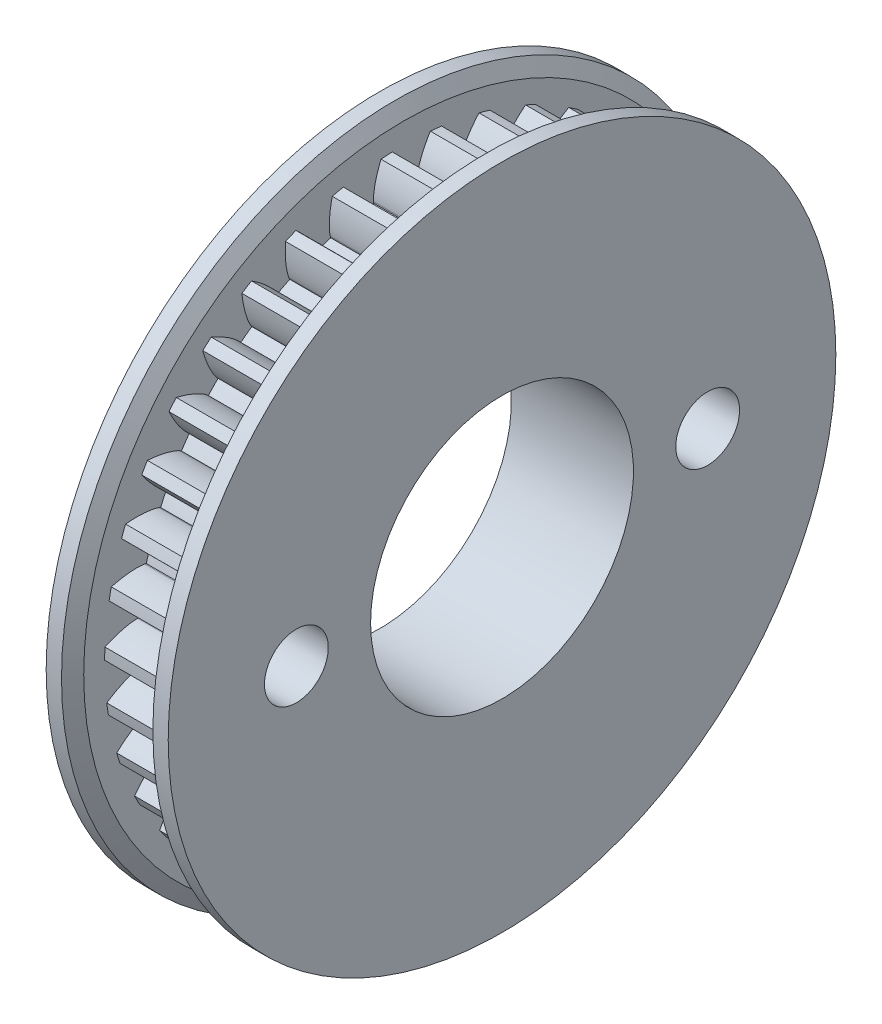
from build123d import *

# Parameters (mm, degrees)
SKETCH1_R                 = 15.915494309
BOSS_EXTRUDE1_DEPTH       = 4
CUT_EXTRUDE1_DEPTH        = 23.860575632
CIRPATTERN6_COUNT         = 38
CIRPATTERN6_COPY_1_DEPTH  = 23.860575632
CIRPATTERN6_COPY_2_DEPTH  = 23.860575632
CIRPATTERN6_COPY_3_DEPTH  = 23.860575632
CIRPATTERN6_COPY_4_DEPTH  = 23.860575632
CIRPATTERN6_COPY_5_DEPTH  = 23.860575632
CIRPATTERN6_COPY_6_DEPTH  = 23.860575632
CIRPATTERN6_COPY_7_DEPTH  = 23.860575632
CIRPATTERN6_COPY_8_DEPTH  = 23.860575632
CIRPATTERN6_COPY_9_DEPTH  = 23.860575632
CIRPATTERN6_COPY_10_DEPTH = 23.860575632
CIRPATTERN6_COPY_11_DEPTH = 23.860575632
CIRPATTERN6_COPY_12_DEPTH = 23.860575632
CIRPATTERN6_COPY_13_DEPTH = 23.860575632
CIRPATTERN6_COPY_14_DEPTH = 23.860575632
CIRPATTERN6_COPY_15_DEPTH = 23.860575632
CIRPATTERN6_COPY_16_DEPTH = 23.860575632
CIRPATTERN6_COPY_17_DEPTH = 23.860575632
CIRPATTERN6_COPY_18_DEPTH = 23.860575632
CIRPATTERN6_COPY_19_DEPTH = 23.860575632
CIRPATTERN6_COPY_20_DEPTH = 23.860575632
CIRPATTERN6_COPY_21_DEPTH = 23.860575632
CIRPATTERN6_COPY_22_DEPTH = 23.860575632
CIRPATTERN6_COPY_23_DEPTH = 23.860575632
CIRPATTERN6_COPY_24_DEPTH = 23.860575632
CIRPATTERN6_COPY_25_DEPTH = 23.860575632
CIRPATTERN6_COPY_26_DEPTH = 23.860575632
CIRPATTERN6_COPY_27_DEPTH = 23.860575632
CIRPATTERN6_COPY_28_DEPTH = 23.860575632
CIRPATTERN6_COPY_29_DEPTH = 23.860575632
CIRPATTERN6_COPY_30_DEPTH = 23.860575632
CIRPATTERN6_COPY_31_DEPTH = 23.860575632
CIRPATTERN6_COPY_32_DEPTH = 23.860575632
CIRPATTERN6_COPY_33_DEPTH = 23.860575632
CIRPATTERN6_COPY_34_DEPTH = 23.860575632
CIRPATTERN6_COPY_35_DEPTH = 23.860575632
CIRPATTERN6_COPY_36_DEPTH = 23.860575632
CIRPATTERN6_COPY_37_DEPTH = 23.860575632
SKETCH6_R                 = 7
CUT_EXTRUDE2_DEPTH        = 26.971268741
M3_CLEARANCE_HOLE1_D      = 3.4
M3_CLEARANCE_HOLE1_DEPTH  = 25.4
M3_CLEARANCE_HOLE1_TIP    = 1.021463052


with BuildPart() as part:
    # Sketch1 → Boss-Extrude1 (new body)
    with BuildSketch(Plane.YZ):
        Circle(SKETCH1_R)
    extrude(amount=BOSS_EXTRUDE1_DEPTH)

    # Sketch3 → Cut-Extrude1 (cut, through all)
    with BuildSketch(Plane.YZ.offset(4)):
        with BuildLine():
            Line((14.202925929, -0.375503544), (15.114438078, -0.399602525))
            Line((15.114438078, -0.399602525), (15.909934819, -0.420634237))
            ThreePointArc((15.909934819, -0.420634237), (15.914104376, -0.210335487), (15.915494309, 0))
            ThreePointArc((15.915494309, 0), (15.912723613, 0.29696184), (15.904412488, 0.593820286))
            add(Edge.make_bspline(
                [(14.207888931, 0), (14.218392868, 0.000222282), (14.247830886, 0.001533609), (14.303361943, 0.006727812), (14.393600453, 0.019046134), (14.507881209, 0.040366865), (14.654509155, 0.074341363), (14.825592044, 0.122557591), (15.011550407, 0.184051363), (15.21131221, 0.260026479), (15.408091076, 0.34376321), (15.60181467, 0.434588501), (15.749413931, 0.509740536), (15.848307882, 0.562876342), (15.899775124, 0.591257164), (15.904412488, 0.593820286)],
                knots=[0, 0, 0, 0, 0, 0.005376748, 0.015083688, 0.02853182, 0.046610139, 0.064854849, 0.092110525, 0.119476175, 0.146842495, 0.174208853, 0.201574955, 0.228941013, 0.231652602, 0.231652602, 0.231652602, 0.231652602, 0.231652602], degree=4))
            Line((14.207888931, 0), (14.125001199, 0))
            ThreePointArc((14.125001199, 0), (14.123767634, -0.186672745), (14.120067152, -0.373312885))
            Line((14.120067152, -0.373312885), (14.202925929, -0.375503544))
        make_face()
    cut_extrude1 = extrude(amount=-CUT_EXTRUDE1_DEPTH, mode=Mode.SUBTRACT)

    # Mirror1: Cut-Extrude1 across plane
    add(cut_extrude1.mirror(Plane(origin=(0, 0, 0), x_dir=(1, 0, 0), z_dir=(0, 0.02642922856327121, 0.9996506869289644))), mode=Mode.SUBTRACT)

    # CirPattern6: Cut-Extrude1 ×38 about axis
    cirpattern6_axis = Axis((4, 0, 0), (-1, 0, 0))
    for i in range(1, CIRPATTERN6_COUNT):
        add(cut_extrude1.rotate(cirpattern6_axis, i * 360 / CIRPATTERN6_COUNT), mode=Mode.SUBTRACT)

    # CirPattern6 copy 1 sketch → CirPattern6 copy 1 (cut, through all)
    with BuildSketch(Plane(origin=(4, 0, 0), x_dir=(0, 0.9762861715350064, -0.21648397462518973), z_dir=(1, 0, 0))):
        with BuildLine():
            Line((14.202925929, 0.375503544), (15.114438078, 0.399602525))
            Line((15.114438078, 0.399602525), (15.909934819, 0.420634237))
            ThreePointArc((15.909934819, 0.420634237), (15.914104376, 0.210335487), (15.915494309, 0))
            ThreePointArc((15.915494309, 0), (15.912723613, -0.29696184), (15.904412488, -0.593820286))
            add(Edge.make_bspline(
                [(14.207888931, 0), (14.218392868, -0.000222282), (14.247830886, -0.001533609), (14.303361943, -0.006727812), (14.393600453, -0.019046134), (14.507881209, -0.040366865), (14.654509155, -0.074341363), (14.825592044, -0.122557591), (15.011550407, -0.184051363), (15.21131221, -0.260026479), (15.408091076, -0.34376321), (15.60181467, -0.434588501), (15.749413931, -0.509740536), (15.848307882, -0.562876342), (15.899775124, -0.591257164), (15.904412488, -0.593820286)],
                knots=[0, 0, 0, 0, 0, 0.005376748, 0.015083688, 0.02853182, 0.046610139, 0.064854849, 0.092110525, 0.119476175, 0.146842495, 0.174208853, 0.201574955, 0.228941013, 0.231652602, 0.231652602, 0.231652602, 0.231652602, 0.231652602], degree=4))
            Line((14.207888931, 0), (14.125001199, 0))
            ThreePointArc((14.125001199, 0), (14.123767634, 0.186672745), (14.120067152, 0.373312885))
            Line((14.120067152, 0.373312885), (14.202925929, 0.375503544))
        make_face()
    extrude(amount=-CIRPATTERN6_COPY_1_DEPTH, mode=Mode.SUBTRACT)

    # CirPattern6 copy 2 sketch → CirPattern6 copy 2 (cut, through all)
    with BuildSketch(Plane(origin=(4, 0, 0), x_dir=(0, 0.9273388095435449, -0.37422283777765464), z_dir=(1, 0, 0))):
        with BuildLine():
            Line((14.202925929, 0.375503544), (15.114438078, 0.399602525))
            Line((15.114438078, 0.399602525), (15.909934819, 0.420634237))
            ThreePointArc((15.909934819, 0.420634237), (15.914104376, 0.210335487), (15.915494309, 0))
            ThreePointArc((15.915494309, 0), (15.912723613, -0.29696184), (15.904412488, -0.593820286))
            add(Edge.make_bspline(
                [(14.207888931, 0), (14.218392868, -0.000222282), (14.247830886, -0.001533609), (14.303361943, -0.006727812), (14.393600453, -0.019046134), (14.507881209, -0.040366865), (14.654509155, -0.074341363), (14.825592044, -0.122557591), (15.011550407, -0.184051363), (15.21131221, -0.260026479), (15.408091076, -0.34376321), (15.60181467, -0.434588501), (15.749413931, -0.509740536), (15.848307882, -0.562876342), (15.899775124, -0.591257164), (15.904412488, -0.593820286)],
                knots=[0, 0, 0, 0, 0, 0.005376748, 0.015083688, 0.02853182, 0.046610139, 0.064854849, 0.092110525, 0.119476175, 0.146842495, 0.174208853, 0.201574955, 0.228941013, 0.231652602, 0.231652602, 0.231652602, 0.231652602, 0.231652602], degree=4))
            Line((14.207888931, 0), (14.125001199, 0))
            ThreePointArc((14.125001199, 0), (14.123767634, 0.186672745), (14.120067152, 0.373312885))
            Line((14.120067152, 0.373312885), (14.202925929, 0.375503544))
        make_face()
    extrude(amount=-CIRPATTERN6_COPY_2_DEPTH, mode=Mode.SUBTRACT)

    # CirPattern6 copy 3 sketch → CirPattern6 copy 3 (cut, through all)
    with BuildSketch(Plane(origin=(4, 0, 0), x_dir=(0, 0.8530960622195933, -0.5217538774416763), z_dir=(1, 0, 0))):
        with BuildLine():
            Line((14.202925929, 0.375503544), (15.114438078, 0.399602525))
            Line((15.114438078, 0.399602525), (15.909934819, 0.420634237))
            ThreePointArc((15.909934819, 0.420634237), (15.914104376, 0.210335487), (15.915494309, 0))
            ThreePointArc((15.915494309, 0), (15.912723613, -0.29696184), (15.904412488, -0.593820286))
            add(Edge.make_bspline(
                [(14.207888931, 0), (14.218392868, -0.000222282), (14.247830886, -0.001533609), (14.303361943, -0.006727812), (14.393600453, -0.019046134), (14.507881209, -0.040366865), (14.654509155, -0.074341363), (14.825592044, -0.122557591), (15.011550407, -0.184051363), (15.21131221, -0.260026479), (15.408091076, -0.34376321), (15.60181467, -0.434588501), (15.749413931, -0.509740536), (15.848307882, -0.562876342), (15.899775124, -0.591257164), (15.904412488, -0.593820286)],
                knots=[0, 0, 0, 0, 0, 0.005376748, 0.015083688, 0.02853182, 0.046610139, 0.064854849, 0.092110525, 0.119476175, 0.146842495, 0.174208853, 0.201574955, 0.228941013, 0.231652602, 0.231652602, 0.231652602, 0.231652602, 0.231652602], degree=4))
            Line((14.207888931, 0), (14.125001199, 0))
            ThreePointArc((14.125001199, 0), (14.123767634, 0.186672745), (14.120067152, 0.373312885))
            Line((14.120067152, 0.373312885), (14.202925929, 0.375503544))
        make_face()
    extrude(amount=-CIRPATTERN6_COPY_3_DEPTH, mode=Mode.SUBTRACT)

    # CirPattern6 copy 4 sketch → CirPattern6 copy 4 (cut, through all)
    with BuildSketch(Plane(origin=(4, 0, 0), x_dir=(0, 0.7555830781737509, -0.6550528314399375), z_dir=(1, 0, 0))):
        with BuildLine():
            Line((14.202925929, 0.375503544), (15.114438078, 0.399602525))
            Line((15.114438078, 0.399602525), (15.909934819, 0.420634237))
            ThreePointArc((15.909934819, 0.420634237), (15.914104376, 0.210335487), (15.915494309, 0))
            ThreePointArc((15.915494309, 0), (15.912723613, -0.29696184), (15.904412488, -0.593820286))
            add(Edge.make_bspline(
                [(14.207888931, 0), (14.218392868, -0.000222282), (14.247830886, -0.001533609), (14.303361943, -0.006727812), (14.393600453, -0.019046134), (14.507881209, -0.040366865), (14.654509155, -0.074341363), (14.825592044, -0.122557591), (15.011550407, -0.184051363), (15.21131221, -0.260026479), (15.408091076, -0.34376321), (15.60181467, -0.434588501), (15.749413931, -0.509740536), (15.848307882, -0.562876342), (15.899775124, -0.591257164), (15.904412488, -0.593820286)],
                knots=[0, 0, 0, 0, 0, 0.005376748, 0.015083688, 0.02853182, 0.046610139, 0.064854849, 0.092110525, 0.119476175, 0.146842495, 0.174208853, 0.201574955, 0.228941013, 0.231652602, 0.231652602, 0.231652602, 0.231652602, 0.231652602], degree=4))
            Line((14.207888931, 0), (14.125001199, 0))
            ThreePointArc((14.125001199, 0), (14.123767634, 0.186672745), (14.120067152, 0.373312885))
            Line((14.120067152, 0.373312885), (14.202925929, 0.375503544))
        make_face()
    extrude(amount=-CIRPATTERN6_COPY_4_DEPTH, mode=Mode.SUBTRACT)

    # CirPattern6 copy 5 sketch → CirPattern6 copy 5 (cut, through all)
    with BuildSketch(Plane(origin=(4, 0, 0), x_dir=(0, 0.637459757413411, -0.7704836517918048), z_dir=(1, 0, 0))):
        with BuildLine():
            Line((14.202925929, 0.375503544), (15.114438078, 0.399602525))
            Line((15.114438078, 0.399602525), (15.909934819, 0.420634237))
            ThreePointArc((15.909934819, 0.420634237), (15.914104376, 0.210335487), (15.915494309, 0))
            ThreePointArc((15.915494309, 0), (15.912723613, -0.29696184), (15.904412488, -0.593820286))
            add(Edge.make_bspline(
                [(14.207888931, 0), (14.218392868, -0.000222282), (14.247830886, -0.001533609), (14.303361943, -0.006727812), (14.393600453, -0.019046134), (14.507881209, -0.040366865), (14.654509155, -0.074341363), (14.825592044, -0.122557591), (15.011550407, -0.184051363), (15.21131221, -0.260026479), (15.408091076, -0.34376321), (15.60181467, -0.434588501), (15.749413931, -0.509740536), (15.848307882, -0.562876342), (15.899775124, -0.591257164), (15.904412488, -0.593820286)],
                knots=[0, 0, 0, 0, 0, 0.005376748, 0.015083688, 0.02853182, 0.046610139, 0.064854849, 0.092110525, 0.119476175, 0.146842495, 0.174208853, 0.201574955, 0.228941013, 0.231652602, 0.231652602, 0.231652602, 0.231652602, 0.231652602], degree=4))
            Line((14.207888931, 0), (14.125001199, 0))
            ThreePointArc((14.125001199, 0), (14.123767634, 0.186672745), (14.120067152, 0.373312885))
            Line((14.120067152, 0.373312885), (14.202925929, 0.375503544))
        make_face()
    extrude(amount=-CIRPATTERN6_COPY_5_DEPTH, mode=Mode.SUBTRACT)

    # CirPattern6 copy 6 sketch → CirPattern6 copy 6 (cut, through all)
    with BuildSketch(Plane(origin=(4, 0, 0), x_dir=(0, 0.5019481962043997, -0.8648976866237703), z_dir=(1, 0, 0))):
        with BuildLine():
            Line((14.202925929, 0.375503544), (15.114438078, 0.399602525))
            Line((15.114438078, 0.399602525), (15.909934819, 0.420634237))
            ThreePointArc((15.909934819, 0.420634237), (15.914104376, 0.210335487), (15.915494309, 0))
            ThreePointArc((15.915494309, 0), (15.912723613, -0.29696184), (15.904412488, -0.593820286))
            add(Edge.make_bspline(
                [(14.207888931, 0), (14.218392868, -0.000222282), (14.247830886, -0.001533609), (14.303361943, -0.006727812), (14.393600453, -0.019046134), (14.507881209, -0.040366865), (14.654509155, -0.074341363), (14.825592044, -0.122557591), (15.011550407, -0.184051363), (15.21131221, -0.260026479), (15.408091076, -0.34376321), (15.60181467, -0.434588501), (15.749413931, -0.509740536), (15.848307882, -0.562876342), (15.899775124, -0.591257164), (15.904412488, -0.593820286)],
                knots=[0, 0, 0, 0, 0, 0.005376748, 0.015083688, 0.02853182, 0.046610139, 0.064854849, 0.092110525, 0.119476175, 0.146842495, 0.174208853, 0.201574955, 0.228941013, 0.231652602, 0.231652602, 0.231652602, 0.231652602, 0.231652602], degree=4))
            Line((14.207888931, 0), (14.125001199, 0))
            ThreePointArc((14.125001199, 0), (14.123767634, 0.186672745), (14.120067152, 0.373312885))
            Line((14.120067152, 0.373312885), (14.202925929, 0.375503544))
        make_face()
    extrude(amount=-CIRPATTERN6_COPY_6_DEPTH, mode=Mode.SUBTRACT)

    # CirPattern6 copy 7 sketch → CirPattern6 copy 7 (cut, through all)
    with BuildSketch(Plane(origin=(4, 0, 0), x_dir=(0, 0.35274479668422287, -0.935719567184638), z_dir=(1, 0, 0))):
        with BuildLine():
            Line((14.202925929, 0.375503544), (15.114438078, 0.399602525))
            Line((15.114438078, 0.399602525), (15.909934819, 0.420634237))
            ThreePointArc((15.909934819, 0.420634237), (15.914104376, 0.210335487), (15.915494309, 0))
            ThreePointArc((15.915494309, 0), (15.912723613, -0.29696184), (15.904412488, -0.593820286))
            add(Edge.make_bspline(
                [(14.207888931, 0), (14.218392868, -0.000222282), (14.247830886, -0.001533609), (14.303361943, -0.006727812), (14.393600453, -0.019046134), (14.507881209, -0.040366865), (14.654509155, -0.074341363), (14.825592044, -0.122557591), (15.011550407, -0.184051363), (15.21131221, -0.260026479), (15.408091076, -0.34376321), (15.60181467, -0.434588501), (15.749413931, -0.509740536), (15.848307882, -0.562876342), (15.899775124, -0.591257164), (15.904412488, -0.593820286)],
                knots=[0, 0, 0, 0, 0, 0.005376748, 0.015083688, 0.02853182, 0.046610139, 0.064854849, 0.092110525, 0.119476175, 0.146842495, 0.174208853, 0.201574955, 0.228941013, 0.231652602, 0.231652602, 0.231652602, 0.231652602, 0.231652602], degree=4))
            Line((14.207888931, 0), (14.125001199, 0))
            ThreePointArc((14.125001199, 0), (14.123767634, 0.186672745), (14.120067152, 0.373312885))
            Line((14.120067152, 0.373312885), (14.202925929, 0.375503544))
        make_face()
    extrude(amount=-CIRPATTERN6_COPY_7_DEPTH, mode=Mode.SUBTRACT)

    # CirPattern6 copy 8 sketch → CirPattern6 copy 8 (cut, through all)
    with BuildSketch(Plane(origin=(4, 0, 0), x_dir=(0, 0.19391943864755726, -0.9810174571915712), z_dir=(1, 0, 0))):
        with BuildLine():
            Line((14.202925929, 0.375503544), (15.114438078, 0.399602525))
            Line((15.114438078, 0.399602525), (15.909934819, 0.420634237))
            ThreePointArc((15.909934819, 0.420634237), (15.914104376, 0.210335487), (15.915494309, 0))
            ThreePointArc((15.915494309, 0), (15.912723613, -0.29696184), (15.904412488, -0.593820286))
            add(Edge.make_bspline(
                [(14.207888931, 0), (14.218392868, -0.000222282), (14.247830886, -0.001533609), (14.303361943, -0.006727812), (14.393600453, -0.019046134), (14.507881209, -0.040366865), (14.654509155, -0.074341363), (14.825592044, -0.122557591), (15.011550407, -0.184051363), (15.21131221, -0.260026479), (15.408091076, -0.34376321), (15.60181467, -0.434588501), (15.749413931, -0.509740536), (15.848307882, -0.562876342), (15.899775124, -0.591257164), (15.904412488, -0.593820286)],
                knots=[0, 0, 0, 0, 0, 0.005376748, 0.015083688, 0.02853182, 0.046610139, 0.064854849, 0.092110525, 0.119476175, 0.146842495, 0.174208853, 0.201574955, 0.228941013, 0.231652602, 0.231652602, 0.231652602, 0.231652602, 0.231652602], degree=4))
            Line((14.207888931, 0), (14.125001199, 0))
            ThreePointArc((14.125001199, 0), (14.123767634, 0.186672745), (14.120067152, 0.373312885))
            Line((14.120067152, 0.373312885), (14.202925929, 0.375503544))
        make_face()
    extrude(amount=-CIRPATTERN6_COPY_8_DEPTH, mode=Mode.SUBTRACT)

    # CirPattern6 copy 9 sketch → CirPattern6 copy 9 (cut, through all)
    with BuildSketch(Plane(origin=(4, 0, 0), x_dir=(0, 0.02980446383483474, -0.9995557482879671), z_dir=(1, 0, 0))):
        with BuildLine():
            Line((14.202925929, 0.375503544), (15.114438078, 0.399602525))
            Line((15.114438078, 0.399602525), (15.909934819, 0.420634237))
            ThreePointArc((15.909934819, 0.420634237), (15.914104376, 0.210335487), (15.915494309, 0))
            ThreePointArc((15.915494309, 0), (15.912723613, -0.29696184), (15.904412488, -0.593820286))
            add(Edge.make_bspline(
                [(14.207888931, 0), (14.218392868, -0.000222282), (14.247830886, -0.001533609), (14.303361943, -0.006727812), (14.393600453, -0.019046134), (14.507881209, -0.040366865), (14.654509155, -0.074341363), (14.825592044, -0.122557591), (15.011550407, -0.184051363), (15.21131221, -0.260026479), (15.408091076, -0.34376321), (15.60181467, -0.434588501), (15.749413931, -0.509740536), (15.848307882, -0.562876342), (15.899775124, -0.591257164), (15.904412488, -0.593820286)],
                knots=[0, 0, 0, 0, 0, 0.005376748, 0.015083688, 0.02853182, 0.046610139, 0.064854849, 0.092110525, 0.119476175, 0.146842495, 0.174208853, 0.201574955, 0.228941013, 0.231652602, 0.231652602, 0.231652602, 0.231652602, 0.231652602], degree=4))
            Line((14.207888931, 0), (14.125001199, 0))
            ThreePointArc((14.125001199, 0), (14.123767634, 0.186672745), (14.120067152, 0.373312885))
            Line((14.120067152, 0.373312885), (14.202925929, 0.375503544))
        make_face()
    extrude(amount=-CIRPATTERN6_COPY_9_DEPTH, mode=Mode.SUBTRACT)

    # CirPattern6 copy 10 sketch → CirPattern6 copy 10 (cut, through all)
    with BuildSketch(Plane(origin=(4, 0, 0), x_dir=(0, -0.13512349905686344, -0.9908287642184344), z_dir=(1, 0, 0))):
        with BuildLine():
            Line((14.202925929, 0.375503544), (15.114438078, 0.399602525))
            Line((15.114438078, 0.399602525), (15.909934819, 0.420634237))
            ThreePointArc((15.909934819, 0.420634237), (15.914104376, 0.210335487), (15.915494309, 0))
            ThreePointArc((15.915494309, 0), (15.912723613, -0.29696184), (15.904412488, -0.593820286))
            add(Edge.make_bspline(
                [(14.207888931, 0), (14.218392868, -0.000222282), (14.247830886, -0.001533609), (14.303361943, -0.006727812), (14.393600453, -0.019046134), (14.507881209, -0.040366865), (14.654509155, -0.074341363), (14.825592044, -0.122557591), (15.011550407, -0.184051363), (15.21131221, -0.260026479), (15.408091076, -0.34376321), (15.60181467, -0.434588501), (15.749413931, -0.509740536), (15.848307882, -0.562876342), (15.899775124, -0.591257164), (15.904412488, -0.593820286)],
                knots=[0, 0, 0, 0, 0, 0.005376748, 0.015083688, 0.02853182, 0.046610139, 0.064854849, 0.092110525, 0.119476175, 0.146842495, 0.174208853, 0.201574955, 0.228941013, 0.231652602, 0.231652602, 0.231652602, 0.231652602, 0.231652602], degree=4))
            Line((14.207888931, 0), (14.125001199, 0))
            ThreePointArc((14.125001199, 0), (14.123767634, 0.186672745), (14.120067152, 0.373312885))
            Line((14.120067152, 0.373312885), (14.202925929, 0.375503544))
        make_face()
    extrude(amount=-CIRPATTERN6_COPY_10_DEPTH, mode=Mode.SUBTRACT)

    # CirPattern6 copy 11 sketch → CirPattern6 copy 11 (cut, through all)
    with BuildSketch(Plane(origin=(4, 0, 0), x_dir=(0, -0.2963656451349633, -0.9550745543588401), z_dir=(1, 0, 0))):
        with BuildLine():
            Line((14.202925929, 0.375503544), (15.114438078, 0.399602525))
            Line((15.114438078, 0.399602525), (15.909934819, 0.420634237))
            ThreePointArc((15.909934819, 0.420634237), (15.914104376, 0.210335487), (15.915494309, 0))
            ThreePointArc((15.915494309, 0), (15.912723613, -0.29696184), (15.904412488, -0.593820286))
            add(Edge.make_bspline(
                [(14.207888931, 0), (14.218392868, -0.000222282), (14.247830886, -0.001533609), (14.303361943, -0.006727812), (14.393600453, -0.019046134), (14.507881209, -0.040366865), (14.654509155, -0.074341363), (14.825592044, -0.122557591), (15.011550407, -0.184051363), (15.21131221, -0.260026479), (15.408091076, -0.34376321), (15.60181467, -0.434588501), (15.749413931, -0.509740536), (15.848307882, -0.562876342), (15.899775124, -0.591257164), (15.904412488, -0.593820286)],
                knots=[0, 0, 0, 0, 0, 0.005376748, 0.015083688, 0.02853182, 0.046610139, 0.064854849, 0.092110525, 0.119476175, 0.146842495, 0.174208853, 0.201574955, 0.228941013, 0.231652602, 0.231652602, 0.231652602, 0.231652602, 0.231652602], degree=4))
            Line((14.207888931, 0), (14.125001199, 0))
            ThreePointArc((14.125001199, 0), (14.123767634, 0.186672745), (14.120067152, 0.373312885))
            Line((14.120067152, 0.373312885), (14.202925929, 0.375503544))
        make_face()
    extrude(amount=-CIRPATTERN6_COPY_11_DEPTH, mode=Mode.SUBTRACT)

    # CirPattern6 copy 12 sketch → CirPattern6 copy 12 (cut, through all)
    with BuildSketch(Plane(origin=(4, 0, 0), x_dir=(0, -0.4495237089813589, -0.8932684003498851), z_dir=(1, 0, 0))):
        with BuildLine():
            Line((14.202925929, 0.375503544), (15.114438078, 0.399602525))
            Line((15.114438078, 0.399602525), (15.909934819, 0.420634237))
            ThreePointArc((15.909934819, 0.420634237), (15.914104376, 0.210335487), (15.915494309, 0))
            ThreePointArc((15.915494309, 0), (15.912723613, -0.29696184), (15.904412488, -0.593820286))
            add(Edge.make_bspline(
                [(14.207888931, 0), (14.218392868, -0.000222282), (14.247830886, -0.001533609), (14.303361943, -0.006727812), (14.393600453, -0.019046134), (14.507881209, -0.040366865), (14.654509155, -0.074341363), (14.825592044, -0.122557591), (15.011550407, -0.184051363), (15.21131221, -0.260026479), (15.408091076, -0.34376321), (15.60181467, -0.434588501), (15.749413931, -0.509740536), (15.848307882, -0.562876342), (15.899775124, -0.591257164), (15.904412488, -0.593820286)],
                knots=[0, 0, 0, 0, 0, 0.005376748, 0.015083688, 0.02853182, 0.046610139, 0.064854849, 0.092110525, 0.119476175, 0.146842495, 0.174208853, 0.201574955, 0.228941013, 0.231652602, 0.231652602, 0.231652602, 0.231652602, 0.231652602], degree=4))
            Line((14.207888931, 0), (14.125001199, 0))
            ThreePointArc((14.125001199, 0), (14.123767634, 0.186672745), (14.120067152, 0.373312885))
            Line((14.120067152, 0.373312885), (14.202925929, 0.375503544))
        make_face()
    extrude(amount=-CIRPATTERN6_COPY_12_DEPTH, mode=Mode.SUBTRACT)

    # CirPattern6 copy 13 sketch → CirPattern6 copy 13 (cut, through all)
    with BuildSketch(Plane(origin=(4, 0, 0), x_dir=(0, -0.5904199378675952, -0.8070962129563147), z_dir=(1, 0, 0))):
        with BuildLine():
            Line((14.202925929, 0.375503544), (15.114438078, 0.399602525))
            Line((15.114438078, 0.399602525), (15.909934819, 0.420634237))
            ThreePointArc((15.909934819, 0.420634237), (15.914104376, 0.210335487), (15.915494309, 0))
            ThreePointArc((15.915494309, 0), (15.912723613, -0.29696184), (15.904412488, -0.593820286))
            add(Edge.make_bspline(
                [(14.207888931, 0), (14.218392868, -0.000222282), (14.247830886, -0.001533609), (14.303361943, -0.006727812), (14.393600453, -0.019046134), (14.507881209, -0.040366865), (14.654509155, -0.074341363), (14.825592044, -0.122557591), (15.011550407, -0.184051363), (15.21131221, -0.260026479), (15.408091076, -0.34376321), (15.60181467, -0.434588501), (15.749413931, -0.509740536), (15.848307882, -0.562876342), (15.899775124, -0.591257164), (15.904412488, -0.593820286)],
                knots=[0, 0, 0, 0, 0, 0.005376748, 0.015083688, 0.02853182, 0.046610139, 0.064854849, 0.092110525, 0.119476175, 0.146842495, 0.174208853, 0.201574955, 0.228941013, 0.231652602, 0.231652602, 0.231652602, 0.231652602, 0.231652602], degree=4))
            Line((14.207888931, 0), (14.125001199, 0))
            ThreePointArc((14.125001199, 0), (14.123767634, 0.186672745), (14.120067152, 0.373312885))
            Line((14.120067152, 0.373312885), (14.202925929, 0.375503544))
        make_face()
    extrude(amount=-CIRPATTERN6_COPY_13_DEPTH, mode=Mode.SUBTRACT)

    # CirPattern6 copy 14 sketch → CirPattern6 copy 14 (cut, through all)
    with BuildSketch(Plane(origin=(4, 0, 0), x_dir=(0, -0.715211049958712, -0.6989085448160988), z_dir=(1, 0, 0))):
        with BuildLine():
            Line((14.202925929, 0.375503544), (15.114438078, 0.399602525))
            Line((15.114438078, 0.399602525), (15.909934819, 0.420634237))
            ThreePointArc((15.909934819, 0.420634237), (15.914104376, 0.210335487), (15.915494309, 0))
            ThreePointArc((15.915494309, 0), (15.912723613, -0.29696184), (15.904412488, -0.593820286))
            add(Edge.make_bspline(
                [(14.207888931, 0), (14.218392868, -0.000222282), (14.247830886, -0.001533609), (14.303361943, -0.006727812), (14.393600453, -0.019046134), (14.507881209, -0.040366865), (14.654509155, -0.074341363), (14.825592044, -0.122557591), (15.011550407, -0.184051363), (15.21131221, -0.260026479), (15.408091076, -0.34376321), (15.60181467, -0.434588501), (15.749413931, -0.509740536), (15.848307882, -0.562876342), (15.899775124, -0.591257164), (15.904412488, -0.593820286)],
                knots=[0, 0, 0, 0, 0, 0.005376748, 0.015083688, 0.02853182, 0.046610139, 0.064854849, 0.092110525, 0.119476175, 0.146842495, 0.174208853, 0.201574955, 0.228941013, 0.231652602, 0.231652602, 0.231652602, 0.231652602, 0.231652602], degree=4))
            Line((14.207888931, 0), (14.125001199, 0))
            ThreePointArc((14.125001199, 0), (14.123767634, 0.186672745), (14.120067152, 0.373312885))
            Line((14.120067152, 0.373312885), (14.202925929, 0.375503544))
        make_face()
    extrude(amount=-CIRPATTERN6_COPY_14_DEPTH, mode=Mode.SUBTRACT)

    # CirPattern6 copy 15 sketch → CirPattern6 copy 15 (cut, through all)
    with BuildSketch(Plane(origin=(4, 0, 0), x_dir=(0, -0.8204930690230144, -0.5716564734918993), z_dir=(1, 0, 0))):
        with BuildLine():
            Line((14.202925929, 0.375503544), (15.114438078, 0.399602525))
            Line((15.114438078, 0.399602525), (15.909934819, 0.420634237))
            ThreePointArc((15.909934819, 0.420634237), (15.914104376, 0.210335487), (15.915494309, 0))
            ThreePointArc((15.915494309, 0), (15.912723613, -0.29696184), (15.904412488, -0.593820286))
            add(Edge.make_bspline(
                [(14.207888931, 0), (14.218392868, -0.000222282), (14.247830886, -0.001533609), (14.303361943, -0.006727812), (14.393600453, -0.019046134), (14.507881209, -0.040366865), (14.654509155, -0.074341363), (14.825592044, -0.122557591), (15.011550407, -0.184051363), (15.21131221, -0.260026479), (15.408091076, -0.34376321), (15.60181467, -0.434588501), (15.749413931, -0.509740536), (15.848307882, -0.562876342), (15.899775124, -0.591257164), (15.904412488, -0.593820286)],
                knots=[0, 0, 0, 0, 0, 0.005376748, 0.015083688, 0.02853182, 0.046610139, 0.064854849, 0.092110525, 0.119476175, 0.146842495, 0.174208853, 0.201574955, 0.228941013, 0.231652602, 0.231652602, 0.231652602, 0.231652602, 0.231652602], degree=4))
            Line((14.207888931, 0), (14.125001199, 0))
            ThreePointArc((14.125001199, 0), (14.123767634, 0.186672745), (14.120067152, 0.373312885))
            Line((14.120067152, 0.373312885), (14.202925929, 0.375503544))
        make_face()
    extrude(amount=-CIRPATTERN6_COPY_15_DEPTH, mode=Mode.SUBTRACT)

    # CirPattern6 copy 16 sketch → CirPattern6 copy 16 (cut, through all)
    with BuildSketch(Plane(origin=(4, 0, 0), x_dir=(0, -0.9033941760301689, -0.42881110376804865), z_dir=(1, 0, 0))):
        with BuildLine():
            Line((14.202925929, 0.375503544), (15.114438078, 0.399602525))
            Line((15.114438078, 0.399602525), (15.909934819, 0.420634237))
            ThreePointArc((15.909934819, 0.420634237), (15.914104376, 0.210335487), (15.915494309, 0))
            ThreePointArc((15.915494309, 0), (15.912723613, -0.29696184), (15.904412488, -0.593820286))
            add(Edge.make_bspline(
                [(14.207888931, 0), (14.218392868, -0.000222282), (14.247830886, -0.001533609), (14.303361943, -0.006727812), (14.393600453, -0.019046134), (14.507881209, -0.040366865), (14.654509155, -0.074341363), (14.825592044, -0.122557591), (15.011550407, -0.184051363), (15.21131221, -0.260026479), (15.408091076, -0.34376321), (15.60181467, -0.434588501), (15.749413931, -0.509740536), (15.848307882, -0.562876342), (15.899775124, -0.591257164), (15.904412488, -0.593820286)],
                knots=[0, 0, 0, 0, 0, 0.005376748, 0.015083688, 0.02853182, 0.046610139, 0.064854849, 0.092110525, 0.119476175, 0.146842495, 0.174208853, 0.201574955, 0.228941013, 0.231652602, 0.231652602, 0.231652602, 0.231652602, 0.231652602], degree=4))
            Line((14.207888931, 0), (14.125001199, 0))
            ThreePointArc((14.125001199, 0), (14.123767634, 0.186672745), (14.120067152, 0.373312885))
            Line((14.120067152, 0.373312885), (14.202925929, 0.375503544))
        make_face()
    extrude(amount=-CIRPATTERN6_COPY_16_DEPTH, mode=Mode.SUBTRACT)

    # CirPattern6 copy 17 sketch → CirPattern6 copy 17 (cut, through all)
    with BuildSketch(Plane(origin=(4, 0, 0), x_dir=(0, -0.9616530448880769, -0.2742688849605261), z_dir=(1, 0, 0))):
        with BuildLine():
            Line((14.202925929, 0.375503544), (15.114438078, 0.399602525))
            Line((15.114438078, 0.399602525), (15.909934819, 0.420634237))
            ThreePointArc((15.909934819, 0.420634237), (15.914104376, 0.210335487), (15.915494309, 0))
            ThreePointArc((15.915494309, 0), (15.912723613, -0.29696184), (15.904412488, -0.593820286))
            add(Edge.make_bspline(
                [(14.207888931, 0), (14.218392868, -0.000222282), (14.247830886, -0.001533609), (14.303361943, -0.006727812), (14.393600453, -0.019046134), (14.507881209, -0.040366865), (14.654509155, -0.074341363), (14.825592044, -0.122557591), (15.011550407, -0.184051363), (15.21131221, -0.260026479), (15.408091076, -0.34376321), (15.60181467, -0.434588501), (15.749413931, -0.509740536), (15.848307882, -0.562876342), (15.899775124, -0.591257164), (15.904412488, -0.593820286)],
                knots=[0, 0, 0, 0, 0, 0.005376748, 0.015083688, 0.02853182, 0.046610139, 0.064854849, 0.092110525, 0.119476175, 0.146842495, 0.174208853, 0.201574955, 0.228941013, 0.231652602, 0.231652602, 0.231652602, 0.231652602, 0.231652602], degree=4))
            Line((14.207888931, 0), (14.125001199, 0))
            ThreePointArc((14.125001199, 0), (14.123767634, 0.186672745), (14.120067152, 0.373312885))
            Line((14.120067152, 0.373312885), (14.202925929, 0.375503544))
        make_face()
    extrude(amount=-CIRPATTERN6_COPY_17_DEPTH, mode=Mode.SUBTRACT)

    # CirPattern6 copy 18 sketch → CirPattern6 copy 18 (cut, through all)
    with BuildSketch(Plane(origin=(4, 0, 0), x_dir=(0, -0.9936805255238317, -0.11224532593690217), z_dir=(1, 0, 0))):
        with BuildLine():
            Line((14.202925929, 0.375503544), (15.114438078, 0.399602525))
            Line((15.114438078, 0.399602525), (15.909934819, 0.420634237))
            ThreePointArc((15.909934819, 0.420634237), (15.914104376, 0.210335487), (15.915494309, 0))
            ThreePointArc((15.915494309, 0), (15.912723613, -0.29696184), (15.904412488, -0.593820286))
            add(Edge.make_bspline(
                [(14.207888931, 0), (14.218392868, -0.000222282), (14.247830886, -0.001533609), (14.303361943, -0.006727812), (14.393600453, -0.019046134), (14.507881209, -0.040366865), (14.654509155, -0.074341363), (14.825592044, -0.122557591), (15.011550407, -0.184051363), (15.21131221, -0.260026479), (15.408091076, -0.34376321), (15.60181467, -0.434588501), (15.749413931, -0.509740536), (15.848307882, -0.562876342), (15.899775124, -0.591257164), (15.904412488, -0.593820286)],
                knots=[0, 0, 0, 0, 0, 0.005376748, 0.015083688, 0.02853182, 0.046610139, 0.064854849, 0.092110525, 0.119476175, 0.146842495, 0.174208853, 0.201574955, 0.228941013, 0.231652602, 0.231652602, 0.231652602, 0.231652602, 0.231652602], degree=4))
            Line((14.207888931, 0), (14.125001199, 0))
            ThreePointArc((14.125001199, 0), (14.123767634, 0.186672745), (14.120067152, 0.373312885))
            Line((14.120067152, 0.373312885), (14.202925929, 0.375503544))
        make_face()
    extrude(amount=-CIRPATTERN6_COPY_18_DEPTH, mode=Mode.SUBTRACT)

    # CirPattern6 copy 19 sketch → CirPattern6 copy 19 (cut, through all)
    with BuildSketch(Plane(origin=(4, 0, 0), x_dir=(0, -0.9986029917551007, 0.05283999297655322), z_dir=(1, 0, 0))):
        with BuildLine():
            Line((14.202925929, 0.375503544), (15.114438078, 0.399602525))
            Line((15.114438078, 0.399602525), (15.909934819, 0.420634237))
            ThreePointArc((15.909934819, 0.420634237), (15.914104376, 0.210335487), (15.915494309, 0))
            ThreePointArc((15.915494309, 0), (15.912723613, -0.29696184), (15.904412488, -0.593820286))
            add(Edge.make_bspline(
                [(14.207888931, 0), (14.218392868, -0.000222282), (14.247830886, -0.001533609), (14.303361943, -0.006727812), (14.393600453, -0.019046134), (14.507881209, -0.040366865), (14.654509155, -0.074341363), (14.825592044, -0.122557591), (15.011550407, -0.184051363), (15.21131221, -0.260026479), (15.408091076, -0.34376321), (15.60181467, -0.434588501), (15.749413931, -0.509740536), (15.848307882, -0.562876342), (15.899775124, -0.591257164), (15.904412488, -0.593820286)],
                knots=[0, 0, 0, 0, 0, 0.005376748, 0.015083688, 0.02853182, 0.046610139, 0.064854849, 0.092110525, 0.119476175, 0.146842495, 0.174208853, 0.201574955, 0.228941013, 0.231652602, 0.231652602, 0.231652602, 0.231652602, 0.231652602], degree=4))
            Line((14.207888931, 0), (14.125001199, 0))
            ThreePointArc((14.125001199, 0), (14.123767634, 0.186672745), (14.120067152, 0.373312885))
            Line((14.120067152, 0.373312885), (14.202925929, 0.375503544))
        make_face()
    extrude(amount=-CIRPATTERN6_COPY_19_DEPTH, mode=Mode.SUBTRACT)

    # CirPattern6 copy 20 sketch → CirPattern6 copy 20 (cut, through all)
    with BuildSketch(Plane(origin=(4, 0, 0), x_dir=(0, -0.9762861715350065, 0.21648397462518965), z_dir=(1, 0, 0))):
        with BuildLine():
            Line((14.202925929, 0.375503544), (15.114438078, 0.399602525))
            Line((15.114438078, 0.399602525), (15.909934819, 0.420634237))
            ThreePointArc((15.909934819, 0.420634237), (15.914104376, 0.210335487), (15.915494309, 0))
            ThreePointArc((15.915494309, 0), (15.912723613, -0.29696184), (15.904412488, -0.593820286))
            add(Edge.make_bspline(
                [(14.207888931, 0), (14.218392868, -0.000222282), (14.247830886, -0.001533609), (14.303361943, -0.006727812), (14.393600453, -0.019046134), (14.507881209, -0.040366865), (14.654509155, -0.074341363), (14.825592044, -0.122557591), (15.011550407, -0.184051363), (15.21131221, -0.260026479), (15.408091076, -0.34376321), (15.60181467, -0.434588501), (15.749413931, -0.509740536), (15.848307882, -0.562876342), (15.899775124, -0.591257164), (15.904412488, -0.593820286)],
                knots=[0, 0, 0, 0, 0, 0.005376748, 0.015083688, 0.02853182, 0.046610139, 0.064854849, 0.092110525, 0.119476175, 0.146842495, 0.174208853, 0.201574955, 0.228941013, 0.231652602, 0.231652602, 0.231652602, 0.231652602, 0.231652602], degree=4))
            Line((14.207888931, 0), (14.125001199, 0))
            ThreePointArc((14.125001199, 0), (14.123767634, 0.186672745), (14.120067152, 0.373312885))
            Line((14.120067152, 0.373312885), (14.202925929, 0.375503544))
        make_face()
    extrude(amount=-CIRPATTERN6_COPY_20_DEPTH, mode=Mode.SUBTRACT)

    # CirPattern6 copy 21 sketch → CirPattern6 copy 21 (cut, through all)
    with BuildSketch(Plane(origin=(4, 0, 0), x_dir=(0, -0.9273388095435451, 0.3742228377776542), z_dir=(1, 0, 0))):
        with BuildLine():
            Line((14.202925929, 0.375503544), (15.114438078, 0.399602525))
            Line((15.114438078, 0.399602525), (15.909934819, 0.420634237))
            ThreePointArc((15.909934819, 0.420634237), (15.914104376, 0.210335487), (15.915494309, 0))
            ThreePointArc((15.915494309, 0), (15.912723613, -0.29696184), (15.904412488, -0.593820286))
            add(Edge.make_bspline(
                [(14.207888931, 0), (14.218392868, -0.000222282), (14.247830886, -0.001533609), (14.303361943, -0.006727812), (14.393600453, -0.019046134), (14.507881209, -0.040366865), (14.654509155, -0.074341363), (14.825592044, -0.122557591), (15.011550407, -0.184051363), (15.21131221, -0.260026479), (15.408091076, -0.34376321), (15.60181467, -0.434588501), (15.749413931, -0.509740536), (15.848307882, -0.562876342), (15.899775124, -0.591257164), (15.904412488, -0.593820286)],
                knots=[0, 0, 0, 0, 0, 0.005376748, 0.015083688, 0.02853182, 0.046610139, 0.064854849, 0.092110525, 0.119476175, 0.146842495, 0.174208853, 0.201574955, 0.228941013, 0.231652602, 0.231652602, 0.231652602, 0.231652602, 0.231652602], degree=4))
            Line((14.207888931, 0), (14.125001199, 0))
            ThreePointArc((14.125001199, 0), (14.123767634, 0.186672745), (14.120067152, 0.373312885))
            Line((14.120067152, 0.373312885), (14.202925929, 0.375503544))
        make_face()
    extrude(amount=-CIRPATTERN6_COPY_21_DEPTH, mode=Mode.SUBTRACT)

    # CirPattern6 copy 22 sketch → CirPattern6 copy 22 (cut, through all)
    with BuildSketch(Plane(origin=(4, 0, 0), x_dir=(0, -0.8530960622195936, 0.5217538774416759), z_dir=(1, 0, 0))):
        with BuildLine():
            Line((14.202925929, 0.375503544), (15.114438078, 0.399602525))
            Line((15.114438078, 0.399602525), (15.909934819, 0.420634237))
            ThreePointArc((15.909934819, 0.420634237), (15.914104376, 0.210335487), (15.915494309, 0))
            ThreePointArc((15.915494309, 0), (15.912723613, -0.29696184), (15.904412488, -0.593820286))
            add(Edge.make_bspline(
                [(14.207888931, 0), (14.218392868, -0.000222282), (14.247830886, -0.001533609), (14.303361943, -0.006727812), (14.393600453, -0.019046134), (14.507881209, -0.040366865), (14.654509155, -0.074341363), (14.825592044, -0.122557591), (15.011550407, -0.184051363), (15.21131221, -0.260026479), (15.408091076, -0.34376321), (15.60181467, -0.434588501), (15.749413931, -0.509740536), (15.848307882, -0.562876342), (15.899775124, -0.591257164), (15.904412488, -0.593820286)],
                knots=[0, 0, 0, 0, 0, 0.005376748, 0.015083688, 0.02853182, 0.046610139, 0.064854849, 0.092110525, 0.119476175, 0.146842495, 0.174208853, 0.201574955, 0.228941013, 0.231652602, 0.231652602, 0.231652602, 0.231652602, 0.231652602], degree=4))
            Line((14.207888931, 0), (14.125001199, 0))
            ThreePointArc((14.125001199, 0), (14.123767634, 0.186672745), (14.120067152, 0.373312885))
            Line((14.120067152, 0.373312885), (14.202925929, 0.375503544))
        make_face()
    extrude(amount=-CIRPATTERN6_COPY_22_DEPTH, mode=Mode.SUBTRACT)

    # CirPattern6 copy 23 sketch → CirPattern6 copy 23 (cut, through all)
    with BuildSketch(Plane(origin=(4, 0, 0), x_dir=(0, -0.755583078173751, 0.6550528314399375), z_dir=(1, 0, 0))):
        with BuildLine():
            Line((14.202925929, 0.375503544), (15.114438078, 0.399602525))
            Line((15.114438078, 0.399602525), (15.909934819, 0.420634237))
            ThreePointArc((15.909934819, 0.420634237), (15.914104376, 0.210335487), (15.915494309, 0))
            ThreePointArc((15.915494309, 0), (15.912723613, -0.29696184), (15.904412488, -0.593820286))
            add(Edge.make_bspline(
                [(14.207888931, 0), (14.218392868, -0.000222282), (14.247830886, -0.001533609), (14.303361943, -0.006727812), (14.393600453, -0.019046134), (14.507881209, -0.040366865), (14.654509155, -0.074341363), (14.825592044, -0.122557591), (15.011550407, -0.184051363), (15.21131221, -0.260026479), (15.408091076, -0.34376321), (15.60181467, -0.434588501), (15.749413931, -0.509740536), (15.848307882, -0.562876342), (15.899775124, -0.591257164), (15.904412488, -0.593820286)],
                knots=[0, 0, 0, 0, 0, 0.005376748, 0.015083688, 0.02853182, 0.046610139, 0.064854849, 0.092110525, 0.119476175, 0.146842495, 0.174208853, 0.201574955, 0.228941013, 0.231652602, 0.231652602, 0.231652602, 0.231652602, 0.231652602], degree=4))
            Line((14.207888931, 0), (14.125001199, 0))
            ThreePointArc((14.125001199, 0), (14.123767634, 0.186672745), (14.120067152, 0.373312885))
            Line((14.120067152, 0.373312885), (14.202925929, 0.375503544))
        make_face()
    extrude(amount=-CIRPATTERN6_COPY_23_DEPTH, mode=Mode.SUBTRACT)

    # CirPattern6 copy 24 sketch → CirPattern6 copy 24 (cut, through all)
    with BuildSketch(Plane(origin=(4, 0, 0), x_dir=(0, -0.6374597574134113, 0.7704836517918046), z_dir=(1, 0, 0))):
        with BuildLine():
            Line((14.202925929, 0.375503544), (15.114438078, 0.399602525))
            Line((15.114438078, 0.399602525), (15.909934819, 0.420634237))
            ThreePointArc((15.909934819, 0.420634237), (15.914104376, 0.210335487), (15.915494309, 0))
            ThreePointArc((15.915494309, 0), (15.912723613, -0.29696184), (15.904412488, -0.593820286))
            add(Edge.make_bspline(
                [(14.207888931, 0), (14.218392868, -0.000222282), (14.247830886, -0.001533609), (14.303361943, -0.006727812), (14.393600453, -0.019046134), (14.507881209, -0.040366865), (14.654509155, -0.074341363), (14.825592044, -0.122557591), (15.011550407, -0.184051363), (15.21131221, -0.260026479), (15.408091076, -0.34376321), (15.60181467, -0.434588501), (15.749413931, -0.509740536), (15.848307882, -0.562876342), (15.899775124, -0.591257164), (15.904412488, -0.593820286)],
                knots=[0, 0, 0, 0, 0, 0.005376748, 0.015083688, 0.02853182, 0.046610139, 0.064854849, 0.092110525, 0.119476175, 0.146842495, 0.174208853, 0.201574955, 0.228941013, 0.231652602, 0.231652602, 0.231652602, 0.231652602, 0.231652602], degree=4))
            Line((14.207888931, 0), (14.125001199, 0))
            ThreePointArc((14.125001199, 0), (14.123767634, 0.186672745), (14.120067152, 0.373312885))
            Line((14.120067152, 0.373312885), (14.202925929, 0.375503544))
        make_face()
    extrude(amount=-CIRPATTERN6_COPY_24_DEPTH, mode=Mode.SUBTRACT)

    # CirPattern6 copy 25 sketch → CirPattern6 copy 25 (cut, through all)
    with BuildSketch(Plane(origin=(4, 0, 0), x_dir=(0, -0.5019481962044002, 0.8648976866237699), z_dir=(1, 0, 0))):
        with BuildLine():
            Line((14.202925929, 0.375503544), (15.114438078, 0.399602525))
            Line((15.114438078, 0.399602525), (15.909934819, 0.420634237))
            ThreePointArc((15.909934819, 0.420634237), (15.914104376, 0.210335487), (15.915494309, 0))
            ThreePointArc((15.915494309, 0), (15.912723613, -0.29696184), (15.904412488, -0.593820286))
            add(Edge.make_bspline(
                [(14.207888931, 0), (14.218392868, -0.000222282), (14.247830886, -0.001533609), (14.303361943, -0.006727812), (14.393600453, -0.019046134), (14.507881209, -0.040366865), (14.654509155, -0.074341363), (14.825592044, -0.122557591), (15.011550407, -0.184051363), (15.21131221, -0.260026479), (15.408091076, -0.34376321), (15.60181467, -0.434588501), (15.749413931, -0.509740536), (15.848307882, -0.562876342), (15.899775124, -0.591257164), (15.904412488, -0.593820286)],
                knots=[0, 0, 0, 0, 0, 0.005376748, 0.015083688, 0.02853182, 0.046610139, 0.064854849, 0.092110525, 0.119476175, 0.146842495, 0.174208853, 0.201574955, 0.228941013, 0.231652602, 0.231652602, 0.231652602, 0.231652602, 0.231652602], degree=4))
            Line((14.207888931, 0), (14.125001199, 0))
            ThreePointArc((14.125001199, 0), (14.123767634, 0.186672745), (14.120067152, 0.373312885))
            Line((14.120067152, 0.373312885), (14.202925929, 0.375503544))
        make_face()
    extrude(amount=-CIRPATTERN6_COPY_25_DEPTH, mode=Mode.SUBTRACT)

    # CirPattern6 copy 26 sketch → CirPattern6 copy 26 (cut, through all)
    with BuildSketch(Plane(origin=(4, 0, 0), x_dir=(0, -0.35274479668422326, 0.9357195671846379), z_dir=(1, 0, 0))):
        with BuildLine():
            Line((14.202925929, 0.375503544), (15.114438078, 0.399602525))
            Line((15.114438078, 0.399602525), (15.909934819, 0.420634237))
            ThreePointArc((15.909934819, 0.420634237), (15.914104376, 0.210335487), (15.915494309, 0))
            ThreePointArc((15.915494309, 0), (15.912723613, -0.29696184), (15.904412488, -0.593820286))
            add(Edge.make_bspline(
                [(14.207888931, 0), (14.218392868, -0.000222282), (14.247830886, -0.001533609), (14.303361943, -0.006727812), (14.393600453, -0.019046134), (14.507881209, -0.040366865), (14.654509155, -0.074341363), (14.825592044, -0.122557591), (15.011550407, -0.184051363), (15.21131221, -0.260026479), (15.408091076, -0.34376321), (15.60181467, -0.434588501), (15.749413931, -0.509740536), (15.848307882, -0.562876342), (15.899775124, -0.591257164), (15.904412488, -0.593820286)],
                knots=[0, 0, 0, 0, 0, 0.005376748, 0.015083688, 0.02853182, 0.046610139, 0.064854849, 0.092110525, 0.119476175, 0.146842495, 0.174208853, 0.201574955, 0.228941013, 0.231652602, 0.231652602, 0.231652602, 0.231652602, 0.231652602], degree=4))
            Line((14.207888931, 0), (14.125001199, 0))
            ThreePointArc((14.125001199, 0), (14.123767634, 0.186672745), (14.120067152, 0.373312885))
            Line((14.120067152, 0.373312885), (14.202925929, 0.375503544))
        make_face()
    extrude(amount=-CIRPATTERN6_COPY_26_DEPTH, mode=Mode.SUBTRACT)

    # CirPattern6 copy 27 sketch → CirPattern6 copy 27 (cut, through all)
    with BuildSketch(Plane(origin=(4, 0, 0), x_dir=(0, -0.19391943864755715, 0.9810174571915712), z_dir=(1, 0, 0))):
        with BuildLine():
            Line((14.202925929, 0.375503544), (15.114438078, 0.399602525))
            Line((15.114438078, 0.399602525), (15.909934819, 0.420634237))
            ThreePointArc((15.909934819, 0.420634237), (15.914104376, 0.210335487), (15.915494309, 0))
            ThreePointArc((15.915494309, 0), (15.912723613, -0.29696184), (15.904412488, -0.593820286))
            add(Edge.make_bspline(
                [(14.207888931, 0), (14.218392868, -0.000222282), (14.247830886, -0.001533609), (14.303361943, -0.006727812), (14.393600453, -0.019046134), (14.507881209, -0.040366865), (14.654509155, -0.074341363), (14.825592044, -0.122557591), (15.011550407, -0.184051363), (15.21131221, -0.260026479), (15.408091076, -0.34376321), (15.60181467, -0.434588501), (15.749413931, -0.509740536), (15.848307882, -0.562876342), (15.899775124, -0.591257164), (15.904412488, -0.593820286)],
                knots=[0, 0, 0, 0, 0, 0.005376748, 0.015083688, 0.02853182, 0.046610139, 0.064854849, 0.092110525, 0.119476175, 0.146842495, 0.174208853, 0.201574955, 0.228941013, 0.231652602, 0.231652602, 0.231652602, 0.231652602, 0.231652602], degree=4))
            Line((14.207888931, 0), (14.125001199, 0))
            ThreePointArc((14.125001199, 0), (14.123767634, 0.186672745), (14.120067152, 0.373312885))
            Line((14.120067152, 0.373312885), (14.202925929, 0.375503544))
        make_face()
    extrude(amount=-CIRPATTERN6_COPY_27_DEPTH, mode=Mode.SUBTRACT)

    # CirPattern6 copy 28 sketch → CirPattern6 copy 28 (cut, through all)
    with BuildSketch(Plane(origin=(4, 0, 0), x_dir=(0, -0.029804463834835086, 0.9995557482879671), z_dir=(1, 0, 0))):
        with BuildLine():
            Line((14.202925929, 0.375503544), (15.114438078, 0.399602525))
            Line((15.114438078, 0.399602525), (15.909934819, 0.420634237))
            ThreePointArc((15.909934819, 0.420634237), (15.914104376, 0.210335487), (15.915494309, 0))
            ThreePointArc((15.915494309, 0), (15.912723613, -0.29696184), (15.904412488, -0.593820286))
            add(Edge.make_bspline(
                [(14.207888931, 0), (14.218392868, -0.000222282), (14.247830886, -0.001533609), (14.303361943, -0.006727812), (14.393600453, -0.019046134), (14.507881209, -0.040366865), (14.654509155, -0.074341363), (14.825592044, -0.122557591), (15.011550407, -0.184051363), (15.21131221, -0.260026479), (15.408091076, -0.34376321), (15.60181467, -0.434588501), (15.749413931, -0.509740536), (15.848307882, -0.562876342), (15.899775124, -0.591257164), (15.904412488, -0.593820286)],
                knots=[0, 0, 0, 0, 0, 0.005376748, 0.015083688, 0.02853182, 0.046610139, 0.064854849, 0.092110525, 0.119476175, 0.146842495, 0.174208853, 0.201574955, 0.228941013, 0.231652602, 0.231652602, 0.231652602, 0.231652602, 0.231652602], degree=4))
            Line((14.207888931, 0), (14.125001199, 0))
            ThreePointArc((14.125001199, 0), (14.123767634, 0.186672745), (14.120067152, 0.373312885))
            Line((14.120067152, 0.373312885), (14.202925929, 0.375503544))
        make_face()
    extrude(amount=-CIRPATTERN6_COPY_28_DEPTH, mode=Mode.SUBTRACT)

    # CirPattern6 copy 29 sketch → CirPattern6 copy 29 (cut, through all)
    with BuildSketch(Plane(origin=(4, 0, 0), x_dir=(0, 0.13512349905686266, 0.9908287642184345), z_dir=(1, 0, 0))):
        with BuildLine():
            Line((14.202925929, 0.375503544), (15.114438078, 0.399602525))
            Line((15.114438078, 0.399602525), (15.909934819, 0.420634237))
            ThreePointArc((15.909934819, 0.420634237), (15.914104376, 0.210335487), (15.915494309, 0))
            ThreePointArc((15.915494309, 0), (15.912723613, -0.29696184), (15.904412488, -0.593820286))
            add(Edge.make_bspline(
                [(14.207888931, 0), (14.218392868, -0.000222282), (14.247830886, -0.001533609), (14.303361943, -0.006727812), (14.393600453, -0.019046134), (14.507881209, -0.040366865), (14.654509155, -0.074341363), (14.825592044, -0.122557591), (15.011550407, -0.184051363), (15.21131221, -0.260026479), (15.408091076, -0.34376321), (15.60181467, -0.434588501), (15.749413931, -0.509740536), (15.848307882, -0.562876342), (15.899775124, -0.591257164), (15.904412488, -0.593820286)],
                knots=[0, 0, 0, 0, 0, 0.005376748, 0.015083688, 0.02853182, 0.046610139, 0.064854849, 0.092110525, 0.119476175, 0.146842495, 0.174208853, 0.201574955, 0.228941013, 0.231652602, 0.231652602, 0.231652602, 0.231652602, 0.231652602], degree=4))
            Line((14.207888931, 0), (14.125001199, 0))
            ThreePointArc((14.125001199, 0), (14.123767634, 0.186672745), (14.120067152, 0.373312885))
            Line((14.120067152, 0.373312885), (14.202925929, 0.375503544))
        make_face()
    extrude(amount=-CIRPATTERN6_COPY_29_DEPTH, mode=Mode.SUBTRACT)

    # CirPattern6 copy 30 sketch → CirPattern6 copy 30 (cut, through all)
    with BuildSketch(Plane(origin=(4, 0, 0), x_dir=(0, 0.29636564513496316, 0.9550745543588401), z_dir=(1, 0, 0))):
        with BuildLine():
            Line((14.202925929, 0.375503544), (15.114438078, 0.399602525))
            Line((15.114438078, 0.399602525), (15.909934819, 0.420634237))
            ThreePointArc((15.909934819, 0.420634237), (15.914104376, 0.210335487), (15.915494309, 0))
            ThreePointArc((15.915494309, 0), (15.912723613, -0.29696184), (15.904412488, -0.593820286))
            add(Edge.make_bspline(
                [(14.207888931, 0), (14.218392868, -0.000222282), (14.247830886, -0.001533609), (14.303361943, -0.006727812), (14.393600453, -0.019046134), (14.507881209, -0.040366865), (14.654509155, -0.074341363), (14.825592044, -0.122557591), (15.011550407, -0.184051363), (15.21131221, -0.260026479), (15.408091076, -0.34376321), (15.60181467, -0.434588501), (15.749413931, -0.509740536), (15.848307882, -0.562876342), (15.899775124, -0.591257164), (15.904412488, -0.593820286)],
                knots=[0, 0, 0, 0, 0, 0.005376748, 0.015083688, 0.02853182, 0.046610139, 0.064854849, 0.092110525, 0.119476175, 0.146842495, 0.174208853, 0.201574955, 0.228941013, 0.231652602, 0.231652602, 0.231652602, 0.231652602, 0.231652602], degree=4))
            Line((14.207888931, 0), (14.125001199, 0))
            ThreePointArc((14.125001199, 0), (14.123767634, 0.186672745), (14.120067152, 0.373312885))
            Line((14.120067152, 0.373312885), (14.202925929, 0.375503544))
        make_face()
    extrude(amount=-CIRPATTERN6_COPY_30_DEPTH, mode=Mode.SUBTRACT)

    # CirPattern6 copy 31 sketch → CirPattern6 copy 31 (cut, through all)
    with BuildSketch(Plane(origin=(4, 0, 0), x_dir=(0, 0.4495237089813592, 0.8932684003498849), z_dir=(1, 0, 0))):
        with BuildLine():
            Line((14.202925929, 0.375503544), (15.114438078, 0.399602525))
            Line((15.114438078, 0.399602525), (15.909934819, 0.420634237))
            ThreePointArc((15.909934819, 0.420634237), (15.914104376, 0.210335487), (15.915494309, 0))
            ThreePointArc((15.915494309, 0), (15.912723613, -0.29696184), (15.904412488, -0.593820286))
            add(Edge.make_bspline(
                [(14.207888931, 0), (14.218392868, -0.000222282), (14.247830886, -0.001533609), (14.303361943, -0.006727812), (14.393600453, -0.019046134), (14.507881209, -0.040366865), (14.654509155, -0.074341363), (14.825592044, -0.122557591), (15.011550407, -0.184051363), (15.21131221, -0.260026479), (15.408091076, -0.34376321), (15.60181467, -0.434588501), (15.749413931, -0.509740536), (15.848307882, -0.562876342), (15.899775124, -0.591257164), (15.904412488, -0.593820286)],
                knots=[0, 0, 0, 0, 0, 0.005376748, 0.015083688, 0.02853182, 0.046610139, 0.064854849, 0.092110525, 0.119476175, 0.146842495, 0.174208853, 0.201574955, 0.228941013, 0.231652602, 0.231652602, 0.231652602, 0.231652602, 0.231652602], degree=4))
            Line((14.207888931, 0), (14.125001199, 0))
            ThreePointArc((14.125001199, 0), (14.123767634, 0.186672745), (14.120067152, 0.373312885))
            Line((14.120067152, 0.373312885), (14.202925929, 0.375503544))
        make_face()
    extrude(amount=-CIRPATTERN6_COPY_31_DEPTH, mode=Mode.SUBTRACT)

    # CirPattern6 copy 32 sketch → CirPattern6 copy 32 (cut, through all)
    with BuildSketch(Plane(origin=(4, 0, 0), x_dir=(0, 0.5904199378675951, 0.8070962129563148), z_dir=(1, 0, 0))):
        with BuildLine():
            Line((14.202925929, 0.375503544), (15.114438078, 0.399602525))
            Line((15.114438078, 0.399602525), (15.909934819, 0.420634237))
            ThreePointArc((15.909934819, 0.420634237), (15.914104376, 0.210335487), (15.915494309, 0))
            ThreePointArc((15.915494309, 0), (15.912723613, -0.29696184), (15.904412488, -0.593820286))
            add(Edge.make_bspline(
                [(14.207888931, 0), (14.218392868, -0.000222282), (14.247830886, -0.001533609), (14.303361943, -0.006727812), (14.393600453, -0.019046134), (14.507881209, -0.040366865), (14.654509155, -0.074341363), (14.825592044, -0.122557591), (15.011550407, -0.184051363), (15.21131221, -0.260026479), (15.408091076, -0.34376321), (15.60181467, -0.434588501), (15.749413931, -0.509740536), (15.848307882, -0.562876342), (15.899775124, -0.591257164), (15.904412488, -0.593820286)],
                knots=[0, 0, 0, 0, 0, 0.005376748, 0.015083688, 0.02853182, 0.046610139, 0.064854849, 0.092110525, 0.119476175, 0.146842495, 0.174208853, 0.201574955, 0.228941013, 0.231652602, 0.231652602, 0.231652602, 0.231652602, 0.231652602], degree=4))
            Line((14.207888931, 0), (14.125001199, 0))
            ThreePointArc((14.125001199, 0), (14.123767634, 0.186672745), (14.120067152, 0.373312885))
            Line((14.120067152, 0.373312885), (14.202925929, 0.375503544))
        make_face()
    extrude(amount=-CIRPATTERN6_COPY_32_DEPTH, mode=Mode.SUBTRACT)

    # CirPattern6 copy 33 sketch → CirPattern6 copy 33 (cut, through all)
    with BuildSketch(Plane(origin=(4, 0, 0), x_dir=(0, 0.7152110499587117, 0.6989085448160991), z_dir=(1, 0, 0))):
        with BuildLine():
            Line((14.202925929, 0.375503544), (15.114438078, 0.399602525))
            Line((15.114438078, 0.399602525), (15.909934819, 0.420634237))
            ThreePointArc((15.909934819, 0.420634237), (15.914104376, 0.210335487), (15.915494309, 0))
            ThreePointArc((15.915494309, 0), (15.912723613, -0.29696184), (15.904412488, -0.593820286))
            add(Edge.make_bspline(
                [(14.207888931, 0), (14.218392868, -0.000222282), (14.247830886, -0.001533609), (14.303361943, -0.006727812), (14.393600453, -0.019046134), (14.507881209, -0.040366865), (14.654509155, -0.074341363), (14.825592044, -0.122557591), (15.011550407, -0.184051363), (15.21131221, -0.260026479), (15.408091076, -0.34376321), (15.60181467, -0.434588501), (15.749413931, -0.509740536), (15.848307882, -0.562876342), (15.899775124, -0.591257164), (15.904412488, -0.593820286)],
                knots=[0, 0, 0, 0, 0, 0.005376748, 0.015083688, 0.02853182, 0.046610139, 0.064854849, 0.092110525, 0.119476175, 0.146842495, 0.174208853, 0.201574955, 0.228941013, 0.231652602, 0.231652602, 0.231652602, 0.231652602, 0.231652602], degree=4))
            Line((14.207888931, 0), (14.125001199, 0))
            ThreePointArc((14.125001199, 0), (14.123767634, 0.186672745), (14.120067152, 0.373312885))
            Line((14.120067152, 0.373312885), (14.202925929, 0.375503544))
        make_face()
    extrude(amount=-CIRPATTERN6_COPY_33_DEPTH, mode=Mode.SUBTRACT)

    # CirPattern6 copy 34 sketch → CirPattern6 copy 34 (cut, through all)
    with BuildSketch(Plane(origin=(4, 0, 0), x_dir=(0, 0.820493069023014, 0.5716564734919002), z_dir=(1, 0, 0))):
        with BuildLine():
            Line((14.202925929, 0.375503544), (15.114438078, 0.399602525))
            Line((15.114438078, 0.399602525), (15.909934819, 0.420634237))
            ThreePointArc((15.909934819, 0.420634237), (15.914104376, 0.210335487), (15.915494309, 0))
            ThreePointArc((15.915494309, 0), (15.912723613, -0.29696184), (15.904412488, -0.593820286))
            add(Edge.make_bspline(
                [(14.207888931, 0), (14.218392868, -0.000222282), (14.247830886, -0.001533609), (14.303361943, -0.006727812), (14.393600453, -0.019046134), (14.507881209, -0.040366865), (14.654509155, -0.074341363), (14.825592044, -0.122557591), (15.011550407, -0.184051363), (15.21131221, -0.260026479), (15.408091076, -0.34376321), (15.60181467, -0.434588501), (15.749413931, -0.509740536), (15.848307882, -0.562876342), (15.899775124, -0.591257164), (15.904412488, -0.593820286)],
                knots=[0, 0, 0, 0, 0, 0.005376748, 0.015083688, 0.02853182, 0.046610139, 0.064854849, 0.092110525, 0.119476175, 0.146842495, 0.174208853, 0.201574955, 0.228941013, 0.231652602, 0.231652602, 0.231652602, 0.231652602, 0.231652602], degree=4))
            Line((14.207888931, 0), (14.125001199, 0))
            ThreePointArc((14.125001199, 0), (14.123767634, 0.186672745), (14.120067152, 0.373312885))
            Line((14.120067152, 0.373312885), (14.202925929, 0.375503544))
        make_face()
    extrude(amount=-CIRPATTERN6_COPY_34_DEPTH, mode=Mode.SUBTRACT)

    # CirPattern6 copy 35 sketch → CirPattern6 copy 35 (cut, through all)
    with BuildSketch(Plane(origin=(4, 0, 0), x_dir=(0, 0.9033941760301687, 0.42881110376804915), z_dir=(1, 0, 0))):
        with BuildLine():
            Line((14.202925929, 0.375503544), (15.114438078, 0.399602525))
            Line((15.114438078, 0.399602525), (15.909934819, 0.420634237))
            ThreePointArc((15.909934819, 0.420634237), (15.914104376, 0.210335487), (15.915494309, 0))
            ThreePointArc((15.915494309, 0), (15.912723613, -0.29696184), (15.904412488, -0.593820286))
            add(Edge.make_bspline(
                [(14.207888931, 0), (14.218392868, -0.000222282), (14.247830886, -0.001533609), (14.303361943, -0.006727812), (14.393600453, -0.019046134), (14.507881209, -0.040366865), (14.654509155, -0.074341363), (14.825592044, -0.122557591), (15.011550407, -0.184051363), (15.21131221, -0.260026479), (15.408091076, -0.34376321), (15.60181467, -0.434588501), (15.749413931, -0.509740536), (15.848307882, -0.562876342), (15.899775124, -0.591257164), (15.904412488, -0.593820286)],
                knots=[0, 0, 0, 0, 0, 0.005376748, 0.015083688, 0.02853182, 0.046610139, 0.064854849, 0.092110525, 0.119476175, 0.146842495, 0.174208853, 0.201574955, 0.228941013, 0.231652602, 0.231652602, 0.231652602, 0.231652602, 0.231652602], degree=4))
            Line((14.207888931, 0), (14.125001199, 0))
            ThreePointArc((14.125001199, 0), (14.123767634, 0.186672745), (14.120067152, 0.373312885))
            Line((14.120067152, 0.373312885), (14.202925929, 0.375503544))
        make_face()
    extrude(amount=-CIRPATTERN6_COPY_35_DEPTH, mode=Mode.SUBTRACT)

    # CirPattern6 copy 36 sketch → CirPattern6 copy 36 (cut, through all)
    with BuildSketch(Plane(origin=(4, 0, 0), x_dir=(0, 0.961653044888077, 0.27426888496052576), z_dir=(1, 0, 0))):
        with BuildLine():
            Line((14.202925929, 0.375503544), (15.114438078, 0.399602525))
            Line((15.114438078, 0.399602525), (15.909934819, 0.420634237))
            ThreePointArc((15.909934819, 0.420634237), (15.914104376, 0.210335487), (15.915494309, 0))
            ThreePointArc((15.915494309, 0), (15.912723613, -0.29696184), (15.904412488, -0.593820286))
            add(Edge.make_bspline(
                [(14.207888931, 0), (14.218392868, -0.000222282), (14.247830886, -0.001533609), (14.303361943, -0.006727812), (14.393600453, -0.019046134), (14.507881209, -0.040366865), (14.654509155, -0.074341363), (14.825592044, -0.122557591), (15.011550407, -0.184051363), (15.21131221, -0.260026479), (15.408091076, -0.34376321), (15.60181467, -0.434588501), (15.749413931, -0.509740536), (15.848307882, -0.562876342), (15.899775124, -0.591257164), (15.904412488, -0.593820286)],
                knots=[0, 0, 0, 0, 0, 0.005376748, 0.015083688, 0.02853182, 0.046610139, 0.064854849, 0.092110525, 0.119476175, 0.146842495, 0.174208853, 0.201574955, 0.228941013, 0.231652602, 0.231652602, 0.231652602, 0.231652602, 0.231652602], degree=4))
            Line((14.207888931, 0), (14.125001199, 0))
            ThreePointArc((14.125001199, 0), (14.123767634, 0.186672745), (14.120067152, 0.373312885))
            Line((14.120067152, 0.373312885), (14.202925929, 0.375503544))
        make_face()
    extrude(amount=-CIRPATTERN6_COPY_36_DEPTH, mode=Mode.SUBTRACT)

    # CirPattern6 copy 37 sketch → CirPattern6 copy 37 (cut, through all)
    with BuildSketch(Plane(origin=(4, 0, 0), x_dir=(0, 0.9936805255238317, 0.11224532593690273), z_dir=(1, 0, 0))):
        with BuildLine():
            Line((14.202925929, 0.375503544), (15.114438078, 0.399602525))
            Line((15.114438078, 0.399602525), (15.909934819, 0.420634237))
            ThreePointArc((15.909934819, 0.420634237), (15.914104376, 0.210335487), (15.915494309, 0))
            ThreePointArc((15.915494309, 0), (15.912723613, -0.29696184), (15.904412488, -0.593820286))
            add(Edge.make_bspline(
                [(14.207888931, 0), (14.218392868, -0.000222282), (14.247830886, -0.001533609), (14.303361943, -0.006727812), (14.393600453, -0.019046134), (14.507881209, -0.040366865), (14.654509155, -0.074341363), (14.825592044, -0.122557591), (15.011550407, -0.184051363), (15.21131221, -0.260026479), (15.408091076, -0.34376321), (15.60181467, -0.434588501), (15.749413931, -0.509740536), (15.848307882, -0.562876342), (15.899775124, -0.591257164), (15.904412488, -0.593820286)],
                knots=[0, 0, 0, 0, 0, 0.005376748, 0.015083688, 0.02853182, 0.046610139, 0.064854849, 0.092110525, 0.119476175, 0.146842495, 0.174208853, 0.201574955, 0.228941013, 0.231652602, 0.231652602, 0.231652602, 0.231652602, 0.231652602], degree=4))
            Line((14.207888931, 0), (14.125001199, 0))
            ThreePointArc((14.125001199, 0), (14.123767634, 0.186672745), (14.120067152, 0.373312885))
            Line((14.120067152, 0.373312885), (14.202925929, 0.375503544))
        make_face()
    extrude(amount=-CIRPATTERN6_COPY_37_DEPTH, mode=Mode.SUBTRACT)

    # Sketch5 → Revolve1 (revolve)
    with BuildSketch(Plane(origin=(0, 0, 0), x_dir=(-1, 0, 0), z_dir=(0, 1, 0))):
        Polygon((-4, 0), (-5.25, 0), (-5.25, 17.78), (-4.433012702, 17.78), (-4, 17.03), align=None)
        Polygon((0, 0), (1.25, 0), (1.25, 17.78), (0.433012702, 17.78), (0, 17.03), align=None)
    revolve(axis=Axis((15.044048523, 0, 0), (-1, 0, 0)))

    # Sketch6 → Cut-Extrude2 (cut, through all)
    with BuildSketch(Plane(origin=(-1.25, 0, 0), x_dir=(0, -1, 0), z_dir=(-1, 0, 0))):
        Circle(SKETCH6_R)
    extrude(amount=-CUT_EXTRUDE2_DEPTH, mode=Mode.SUBTRACT)

    # M3 Clearance Hole1
    with Locations(Plane.ZY.offset(1.25)):
        with Locations((10.95375, 0), (-10.95375, 0)):
            Hole(M3_CLEARANCE_HOLE1_D / 2, depth=M3_CLEARANCE_HOLE1_DEPTH)
            with Locations((0, 0, -(M3_CLEARANCE_HOLE1_DEPTH + M3_CLEARANCE_HOLE1_TIP / 2))):  # 118° drill point
                Cone(0, M3_CLEARANCE_HOLE1_D / 2, M3_CLEARANCE_HOLE1_TIP, mode=Mode.SUBTRACT)


solid = part.part
